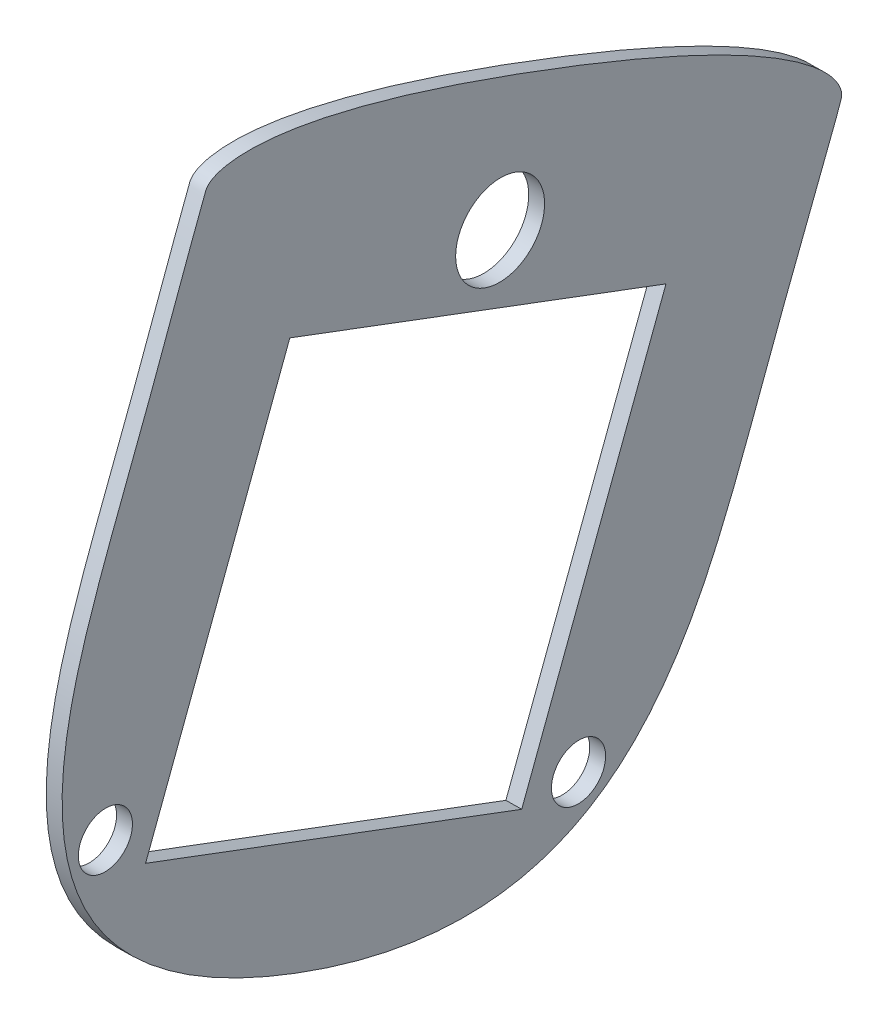
from build123d import *

# Parameters (mm, degrees)
SKETCH3_R               = 11.5
SKETCH3_R_2             = 7
BOSS_EXTRUDE1_DEPTH     = 4
CUT_EXTRUDE1_DEPTH      = 215.260535492
CUT_EXTRUDE1_DEPTH_BACK = 215.260535492


with BuildPart() as part:
    # Sketch3 → Boss-Extrude1 (new body)
    with BuildSketch(Plane(origin=(-1179.548631244, -0.000116963, 14.971959902), x_dir=(0.012691934504714668, 1.258519915397729e-09, 0.9999194541554475), z_dir=(-0.9999194541554426, -9.915104323779702e-08, 0.01269193450471473))):
        with BuildLine():
            add(Edge.make_bspline(
                [(84.377905998, 170.073349611), (84.159146209, 170.614103737), (83.611445829, 171.645847401), (82.482488155, 172.968186199), (81.127474205, 174.032815338), (79.625504141, 174.851852168), (78.048065363, 175.46773216), (75.883744714, 176.067351893), (73.137504594, 176.493777281), (69.848329994, 176.668544918), (66.593182125, 176.609478461), (63.378982778, 176.382288344), (60.20731945, 176.028236357), (57.075408808, 175.575862287), (53.980573733, 175.044418403), (50.919287132, 174.448332656), (47.88858994, 173.797522358), (44.885549546, 173.100779506), (40.914701349, 172.117751202), (36.006584389, 170.801928289), (30.186228838, 169.112782921), (24.416677375, 167.331209331), (18.680858867, 165.470954437), (12.962867526, 163.537381585), (7.246752851, 161.536551279), (-0.392782545, 158.779747051), (-6.165961293, 156.613052059), (-13.94829591, 153.628587787), (-19.689671295, 151.379544623), (-27.213353042, 148.32138638), (-32.801411813, 145.987168864), (-38.34590917, 143.60168497), (-43.854658394, 141.149761563), (-49.33590569, 138.616774109), (-54.793159015, 135.98108416), (-59.322515753, 133.677749539), (-62.932447741, 131.753643877), (-65.631328698, 130.263773352), (-68.320076039, 128.721252072), (-70.99499306, 127.117580989), (-73.651650051, 125.443406131), (-76.283024477, 123.685640179), (-78.878235649, 121.828176014), (-81.420273295, 119.847929263), (-83.880369486, 117.71527683), (-86.209443734, 115.385980118), (-87.966528206, 113.232572142), (-89.175083533, 111.339467663), (-89.936337543, 109.826689125), (-90.505629637, 108.213285186), (-90.801403008, 106.515492236), (-90.756707116, 104.777199898), (-90.474046755, 103.643699911), (-90.084384795, 102.569480158), (-89.841034016, 101.911994363), (-89.541465442, 101.124116148), (-89.39022558, 100.730499307), (-89.238048509, 100.337045258), (-89.085953699, 99.943392047), (-88.933536811, 99.549679266), (-88.730132992, 99.024564877), (-88.373481405, 98.105259575), (-87.862190511, 96.790888427), (-87.245924635, 95.211881522), (-86.627148474, 93.631055189), (-86.006043621, 92.048360056), (-85.382804113, 90.46374254), (-84.757617465, 88.87715131), (-84.130649567, 87.288544234), (-83.502064493, 85.697879827), (-82.662014846, 83.574195152), (-81.608733884, 80.914237535), (-80.340964507, 77.713392714), (-79.070680925, 74.503319887), (-77.799405763, 71.283624353), (-76.528661796, 68.053911872), (-75.259433457, 64.814004725), (-73.992705385, 61.563725615), (-72.730871393, 58.302409625), (-71.476325612, 55.029392149), (-69.810026434, 50.651412822), (-67.733040223, 45.155857397), (-65.192889969, 38.548535597), (-63.002092293, 33.047031135), (-61.179682785, 28.661451936), (-60.006324985, 25.929654584), (-59.043849556, 23.751341903), (-58.309275854, 22.121773372), (-57.56111242, 20.496992747), (-56.798597272, 18.877580965), (-56.02074925, 17.264200326), (-55.227016605, 15.657353665), (-54.415921139, 14.057888772), (-52.755061989, 10.875871272), (-50.113640526, 6.170533326), (-46.214055624, 0.106202959), (-41.879815211, -5.682640377), (-37.071022669, -11.095491143), (-31.749304366, -16.030968238), (-26.892659915, -19.643471605), (-22.77171096, -22.182742504), (-18.509010649, -24.473419396), (-12.935749295, -26.848778135), (-5.968718292, -28.897564796), (1.173532604, -30.167771585), (8.394625718, -30.72426012), (15.629246847, -30.639249774), (22.822176795, -29.99272502), (29.944943646, -28.856179071), (36.971413373, -27.310529127), (46.200981004, -24.782274948), (52.958186926, -22.450860484), (61.81972476, -19.052528076), (68.404073328, -16.267470827), (76.95838131, -11.975451151), (83.217088787, -8.426029178), (89.273667966, -4.508006235), (95.054577362, -0.17870119), (100.490854379, 4.595986977), (105.487967549, 9.838586932), (109.949080227, 15.559099084), (113.759190042, 21.741276151), (116.314593096, 27.234185766), (117.952211322, 31.787728825), (119.31821366, 36.431290069), (120.513597166, 42.364707849), (121.170203082, 49.592689871), (121.126324228, 56.832595149), (120.478268293, 64.034720651), (119.322900557, 71.151036814), (118.140760893, 76.415668184), (117.248089102, 79.892054693), (116.781726531, 81.623608795), (116.297499658, 83.349034553), (115.797104501, 85.068701615), (115.281277137, 86.782601375), (114.751194296, 88.490899321), (114.207808244, 90.193672228), (113.466976478, 92.456831493), (112.512877939, 95.2725252), (110.935633256, 99.751829279), (108.886186051, 105.307189462), (106.357132583, 111.918384124), (104.227035857, 117.393292318), (102.538795023, 121.76266191), (101.283192002, 125.035142736), (100.040826281, 128.303809705), (98.809473322, 131.567557235), (97.586908616, 134.825280211), (96.372281382, 138.076452947), (95.164740704, 141.32055023), (93.962890537, 144.556847836), (92.765334624, 147.784622), (91.769947764, 150.466802963), (90.974582637, 152.607652643), (90.37838073, 154.210763325), (89.782350048, 155.811268218), (89.186340893, 157.409088573), (88.590201531, 159.004144829), (87.993758439, 160.596349912), (87.396830825, 162.185613775), (86.799251704, 163.771852109), (86.300563928, 165.091116339), (85.951056972, 166.013206231), (85.751175589, 166.539698033), (85.601252796, 166.934387123), (85.451115071, 167.328812398), (85.301183692, 167.723146525), (85.150455373, 168.116984379), (84.846354037, 168.903163888), (84.587677769, 169.554813042), (84.377905998, 170.073349611)],
                knots=[0, 0, 0, 0, 0.002677759, 0.005355518, 0.008033277, 0.010711036, 0.013388795, 0.016066554, 0.021422071, 0.026777589, 0.032133107, 0.037488625, 0.042844143, 0.048199661, 0.053555179, 0.058910696, 0.064266214, 0.069621732, 0.07497725, 0.085688286, 0.096399321, 0.107110357, 0.117821393, 0.128532429, 0.139243464, 0.1499545, 0.171376571, 0.171376571, 0.192798208, 0.203509027, 0.214219845, 0.224930663, 0.235641482, 0.2463523, 0.257063118, 0.267773937, 0.273129346, 0.278484755, 0.283840164, 0.289195574, 0.294550983, 0.299906392, 0.305261801, 0.31061721, 0.31597262, 0.321328029, 0.326683438, 0.329361143, 0.332038847, 0.334716552, 0.337394256, 0.340071961, 0.342749665, 0.342749665, 0.345316694, 0.345958451, 0.346600208, 0.347241965, 0.347883722, 0.348525479, 0.349167236, 0.350450751, 0.353017779, 0.355584807, 0.358151836, 0.360718864, 0.363285893, 0.365852921, 0.368419949, 0.370986978, 0.373554006, 0.378688063, 0.38382212, 0.388956176, 0.394090233, 0.39922429, 0.404358347, 0.409492403, 0.41462646, 0.419760517, 0.424894574, 0.435162687, 0.445430801, 0.455698914, 0.460832971, 0.465967028, 0.468534056, 0.471101084, 0.473668113, 0.476235141, 0.478802169, 0.481369198, 0.483936226, 0.486503255, 0.496771368, 0.507039482, 0.517307595, 0.527575709, 0.537843822, 0.548111936, 0.553245992, 0.558380049, 0.568648163, 0.578916276, 0.58918439, 0.599452503, 0.609720617, 0.61998873, 0.630256844, 0.640524957, 0.650793071, 0.671329298, 0.671329298, 0.691871217, 0.702142176, 0.712413135, 0.722684095, 0.732955054, 0.743226014, 0.753496973, 0.763767933, 0.774038892, 0.784309852, 0.789445331, 0.794580811, 0.80485177, 0.81512273, 0.825393689, 0.835664649, 0.845935608, 0.856206568, 0.858774308, 0.861342047, 0.863909787, 0.866477527, 0.869045267, 0.871613007, 0.874180747, 0.876748487, 0.881883966, 0.887019446, 0.897290406, 0.907561365, 0.917832324, 0.922967804, 0.928103284, 0.933238764, 0.938374243, 0.943509723, 0.948645203, 0.953780682, 0.958916162, 0.964051642, 0.969187122, 0.971754862, 0.974322601, 0.976890341, 0.979458081, 0.982025821, 0.984593561, 0.987161301, 0.989729041, 0.99229678, 0.99358065, 0.994222585, 0.99486452, 0.995506455, 0.99614839, 0.996790325, 0.99743226, 1, 1, 1, 1], degree=3))
        make_face()
        with Locations((3.088369787, 120.842225121)):
            Circle(SKETCH3_R, mode=Mode.SUBTRACT)
        with Locations((-17.186648299, -9.215855238)):
            Circle(SKETCH3_R_2, mode=Mode.SUBTRACT)
        Polygon((94.736446449, 27.279702875), (-2.498711879, -10.009217528), (-39.787632282, 87.2259408), (57.447526046, 124.514861203), align=None, mode=Mode.SUBTRACT)
        with Locations((105.127599262, 37.690699139)):
            Circle(SKETCH3_R_2, mode=Mode.SUBTRACT)
    extrude(amount=-BOSS_EXTRUDE1_DEPTH)

    # Sketch7 → Cut-Extrude1 (cut, two sides: drawn at the far end of the back side and taken through both)
    with BuildSketch(Plane(origin=(-1175.548953427, -0.000116566, 14.921192164), x_dir=(-0.012691934504714949, -1.2585199174118205e-09, -0.9999194541554475), z_dir=(0.9999194541554426, 9.915104339647264e-08, -0.012691934504715011)).offset(-CUT_EXTRUDE1_DEPTH_BACK)):
        with BuildLine():
            add(Edge.make_bspline(
                [(-84.377905998, 170.073349611), (-84.587677769, 169.554813042), (-84.846354037, 168.903163888), (-85.150455373, 168.116984379), (-85.301183692, 167.723146525), (-85.451115071, 167.328812398), (-85.601252796, 166.934387123), (-85.751175589, 166.539698033), (-85.951056972, 166.013206232), (-86.300563928, 165.091116339), (-86.799251704, 163.771852109), (-87.396830825, 162.185613775), (-87.993758439, 160.596349912), (-88.590201531, 159.004144829), (-89.186340893, 157.409088573), (-89.782350048, 155.811268218), (-90.37838073, 154.210763325), (-90.974582637, 152.607652643), (-91.769947764, 150.466802963), (-92.765334624, 147.784622001), (-93.962890537, 144.556847836), (-95.164740704, 141.32055023), (-96.372281382, 138.076452947), (-97.586908616, 134.825280211), (-98.809473322, 131.567557235), (-100.040826281, 128.303809705), (-101.283192002, 125.035142736), (-102.538795023, 121.76266191), (-104.227035857, 117.393292318), (-106.357132583, 111.918384124), (-108.886186051, 105.307189462), (-110.935633256, 99.751829279), (-112.512877939, 95.2725252), (-113.466976478, 92.456831493), (-114.207808244, 90.193672228), (-114.751194296, 88.490899321), (-115.281277137, 86.782601375), (-115.797104501, 85.068701616), (-116.297499658, 83.349034553), (-116.781726531, 81.623608795), (-117.248089102, 79.892054693), (-118.140760893, 76.415668184), (-119.322900557, 71.151036814), (-120.478268293, 64.034720651), (-121.126324228, 56.832595149), (-121.170203082, 49.592689871), (-120.513597166, 42.364707849), (-119.31821366, 36.431290069), (-117.952211322, 31.787728825), (-116.314593096, 27.234185766), (-113.759190042, 21.741276151), (-109.949080227, 15.559099084), (-105.487967549, 9.838586932), (-100.490854379, 4.595986977), (-95.054577362, -0.17870119), (-89.273667966, -4.508006235), (-83.217088787, -8.426029178), (-76.95838131, -11.975451151), (-68.404073328, -16.267470827), (-61.81972476, -19.052528076), (-52.958186926, -22.450860484), (-46.200981004, -24.782274948), (-36.971413373, -27.310529127), (-29.944943646, -28.856179071), (-22.822176795, -29.99272502), (-15.629246847, -30.639249774), (-8.394625718, -30.72426012), (-1.173532604, -30.167771585), (5.968718292, -28.897564796), (12.935749295, -26.848778135), (18.509010649, -24.473419396), (22.77171096, -22.182742504), (26.892659915, -19.643471605), (31.749304366, -16.030968238), (37.071022669, -11.095491143), (41.879815211, -5.682640377), (46.214055624, 0.106202959), (50.113640526, 6.170533326), (52.755061989, 10.875871272), (54.415921139, 14.057888772), (55.227016605, 15.657353665), (56.02074925, 17.264200326), (56.798597272, 18.877580965), (57.561112421, 20.496992747), (58.309275854, 22.121773372), (59.043849556, 23.751341903), (60.006324985, 25.929654584), (61.179682785, 28.661451936), (63.002092293, 33.047031135), (65.192889969, 38.548535597), (67.733040223, 45.155857397), (69.810026434, 50.651412822), (71.476325612, 55.029392149), (72.730871393, 58.302409625), (73.992705385, 61.563725615), (75.259433457, 64.814004725), (76.528661796, 68.053911872), (77.799405763, 71.283624353), (79.070680925, 74.503319887), (80.340964507, 77.713392714), (81.608733884, 80.914237535), (82.662014846, 83.574195152), (83.502064493, 85.697879827), (84.130649567, 87.288544235), (84.757617465, 88.87715131), (85.382804113, 90.46374254), (86.006043621, 92.048360056), (86.627148474, 93.631055189), (87.245924635, 95.211881522), (87.862190511, 96.790888427), (88.373481405, 98.105259575), (88.730132992, 99.024564877), (88.933536811, 99.549679266), (89.085953699, 99.943392047), (89.238048509, 100.337045258), (89.39022558, 100.730499307), (89.541465442, 101.124116148), (89.841034016, 101.911994363), (90.084384795, 102.569480158), (90.474046755, 103.643699911), (90.756707116, 104.777199898), (90.801403008, 106.515492236), (90.505629637, 108.213285186), (89.936337543, 109.826689125), (89.175083533, 111.339467663), (87.966528206, 113.232572142), (86.209443734, 115.385980118), (83.880369486, 117.71527683), (81.420273295, 119.847929263), (78.878235649, 121.828176014), (76.283024477, 123.685640179), (73.651650051, 125.443406131), (70.99499306, 127.117580989), (68.320076039, 128.721252072), (65.631328698, 130.263773352), (62.932447741, 131.753643877), (59.322515753, 133.677749539), (54.793159015, 135.98108416), (49.33590569, 138.616774109), (43.854658394, 141.149761563), (38.34590917, 143.60168497), (32.801411813, 145.987168864), (27.213353042, 148.32138638), (19.689671295, 151.379544623), (13.94829591, 153.628587787), (6.165961293, 156.613052059), (0.392782545, 158.779747051), (-7.246752851, 161.536551279), (-12.962867526, 163.537381585), (-18.680858867, 165.470954437), (-24.416677375, 167.331209331), (-30.186228838, 169.112782921), (-36.006584389, 170.801928289), (-40.914701349, 172.117751202), (-44.885549546, 173.100779506), (-47.88858994, 173.797522358), (-50.919287132, 174.448332656), (-53.980573733, 175.044418403), (-57.075408808, 175.575862287), (-60.20731945, 176.028236357), (-63.378982778, 176.382288344), (-66.593182125, 176.609478461), (-69.848329994, 176.668544918), (-73.137504594, 176.493777281), (-75.883744714, 176.067351893), (-78.048065363, 175.46773216), (-79.625504141, 174.851852168), (-81.127474205, 174.032815338), (-82.482488155, 172.968186199), (-83.611445829, 171.645847401), (-84.159146209, 170.614103737), (-84.377905998, 170.073349611)],
                knots=[0, 0, 0, 0, 0.00256774, 0.003209675, 0.00385161, 0.004493545, 0.00513548, 0.005777415, 0.00641935, 0.00770322, 0.010270959, 0.012838699, 0.015406439, 0.017974179, 0.020541919, 0.023109659, 0.025677399, 0.028245138, 0.030812878, 0.035948358, 0.041083838, 0.046219318, 0.051354797, 0.056490277, 0.061625757, 0.066761236, 0.071896716, 0.077032196, 0.082167676, 0.092438635, 0.102709594, 0.112980554, 0.118116034, 0.123251513, 0.125819253, 0.128386993, 0.130954733, 0.133522473, 0.136090213, 0.138657953, 0.141225692, 0.143793432, 0.154064392, 0.164335351, 0.174606311, 0.18487727, 0.19514823, 0.205419189, 0.210554669, 0.215690148, 0.225961108, 0.236232067, 0.246503027, 0.256773986, 0.267044946, 0.277315905, 0.287586865, 0.297857824, 0.308128783, 0.328670702, 0.328670702, 0.349206929, 0.359475043, 0.369743156, 0.38001127, 0.390279383, 0.400547497, 0.41081561, 0.421083724, 0.431351837, 0.441619951, 0.446754008, 0.451888064, 0.462156178, 0.472424291, 0.482692405, 0.492960518, 0.503228632, 0.513496745, 0.516063774, 0.518630802, 0.521197831, 0.523764859, 0.526331887, 0.528898916, 0.531465944, 0.534032972, 0.539167029, 0.544301086, 0.554569199, 0.564837313, 0.575105426, 0.580239483, 0.58537354, 0.590507597, 0.595641653, 0.60077571, 0.605909767, 0.611043824, 0.61617788, 0.621311937, 0.626445994, 0.629013022, 0.631580051, 0.634147079, 0.636714107, 0.639281136, 0.641848164, 0.644415193, 0.646982221, 0.649549249, 0.650832764, 0.651474521, 0.652116278, 0.652758035, 0.653399792, 0.654041549, 0.654683306, 0.657250335, 0.657250335, 0.659928039, 0.662605744, 0.665283448, 0.667961153, 0.670638857, 0.673316562, 0.678671971, 0.68402738, 0.68938279, 0.694738199, 0.700093608, 0.705449017, 0.710804426, 0.716159836, 0.721515245, 0.726870654, 0.732226063, 0.742936882, 0.7536477, 0.764358518, 0.775069337, 0.785780155, 0.796490973, 0.807201792, 0.828623429, 0.828623429, 0.8500455, 0.860756536, 0.871467571, 0.882178607, 0.892889643, 0.903600679, 0.914311714, 0.92502275, 0.930378268, 0.935733786, 0.941089304, 0.946444821, 0.951800339, 0.957155857, 0.962511375, 0.967866893, 0.973222411, 0.978577929, 0.983933446, 0.986611205, 0.989288964, 0.991966723, 0.994644482, 0.997322241, 1, 1, 1, 1], degree=3))
        make_face()
        with BuildLine():
            add(Edge.make_bspline(
                [(-55.838187915, -16.709006158), (-52.759337997, -17.889720928), (-49.661983597, -18.990343471), (-43.424834776, -21.007897067), (-40.285339282, -21.926121954), (-33.95577084, -23.543659302), (-30.765739806, -24.243153174), (-24.323562972, -25.373292), (-21.071285257, -25.80336599), (-16.956515566, -26.127044786), (-16.13107285, -26.181008467), (-14.474843208, -26.265804689), (-13.644083138, -26.296583322), (-11.159336117, -26.351552112), (-9.507722441, -26.33871842), (-4.56891853, -26.137757422), (-1.297671445, -25.78812209), (2.75947241, -25.027771127), (3.569293687, -24.859416622), (5.185532941, -24.48823135), (5.993774985, -24.284843975), (8.399228703, -23.62386815), (9.971586882, -23.117864616), (14.59508484, -21.404330649), (17.551875111, -19.999661846), (21.794962246, -17.49127934), (23.177855526, -16.589398802), (25.205437134, -15.138878945), (25.873321109, -14.639057075), (27.181089383, -13.61683966), (27.82258487, -13.0932523), (30.970670269, -10.415491982), (33.301165917, -8.083945447), (36.567419196, -4.355468218), (37.618355058, -3.072810508), (39.646972848, -0.440910767), (40.616764085, 0.89780165), (43.41158056, 4.97251373), (45.123166438, 7.766516639), (48.319174891, 13.470674457), (49.80192959, 16.381682177), (52.604978389, 22.286766155), (53.932733295, 25.277027591), (57.766509503, 34.324247615), (60.125505516, 40.458843544), (63.606479044, 49.676664863), (64.757269322, 52.75289458), (67.079227522, 58.897611358), (68.252385001, 61.965346434), (71.805480144, 71.155752316), (74.213167247, 77.267444835), (79.035873395, 89.487950535), (81.4480822, 95.597900163), (83.986552852, 102.09928969), (84.135965374, 102.481689522), (84.425807877, 103.249939387), (84.567492146, 103.635367968), (84.77554294, 104.214978023), (84.878518361, 104.505119663), (84.980118287, 104.795702276), (85.047566655, 104.98951536), (85.079528822, 105.08698679), (85.158366178, 105.384866893), (85.192220288, 105.591761774), (85.218840022, 106.001049334), (85.212210831, 106.204511025), (85.142942631, 106.811968564), (85.034682908, 107.215103604), (84.756266114, 107.982246014), (84.58391238, 108.351859183), (84.196478762, 109.07309285), (83.981597468, 109.423824913), (83.529832597, 110.100642332), (83.291405501, 110.428377399), (82.547651702, 111.387356723), (82.015005816, 111.995356412), (80.90121655, 113.170091628), (80.319687169, 113.737050706), (78.523285007, 115.390418779), (77.270566549, 116.418862513), (74.700393813, 118.389068762), (73.381782646, 119.329282204), (70.698288152, 121.147750697), (69.331688183, 122.026795772), (65.195549199, 124.584259715), (62.387747704, 126.186203749), (56.709877987, 129.26273903), (53.839157229, 130.73599566), (48.05301442, 133.591082335), (45.137324469, 134.972364449), (36.339127875, 139.011642383), (30.406163247, 141.566437578), (18.451721324, 146.494994931), (12.437018382, 148.86491324), (0.35754279, 153.46238524), (-5.709468954, 155.687268268), (-17.919710477, 159.930649526), (-24.065773928, 161.95253874), (-33.353609542, 164.737568455), (-36.461495834, 165.624091402), (-42.709502296, 167.284247216), (-45.851639202, 168.058795114), (-50.590156542, 169.093614563), (-52.173909492, 169.417459754), (-55.352414722, 170.01051922), (-56.948045582, 170.280112504), (-60.149000466, 170.746654764), (-61.753664218, 170.943774593), (-64.975016537, 171.234172775), (-66.592147959, 171.328539092), (-69.016230348, 171.346695587), (-69.82447795, 171.331719432), (-71.441563727, 171.245353904), (-72.246521587, 171.174124865), (-73.839453931, 170.95102252), (-74.628475547, 170.80034663), (-75.792869188, 170.473749314), (-76.177879858, 170.348483587), (-76.938002992, 170.045932306), (-77.306782857, 169.871111386), (-78.004511435, 169.450955954), (-78.338069271, 169.204193987), (-78.755434382, 168.759826777), (-78.882714584, 168.596790562), (-79.046744367, 168.337519906), (-79.096768841, 168.249130006), (-79.188247373, 168.068727684), (-79.228553078, 167.976229878), (-79.579983448, 167.138964498), (-79.883718859, 166.391073652), (-80.318893746, 165.260602826), (-80.460330216, 164.882248938), (-80.745038826, 164.126320976), (-80.887268511, 163.748310365), (-81.313688453, 162.614177839), (-81.597507197, 161.857916914), (-84.149346677, 155.050622227), (-86.400830358, 148.993396144), (-90.916048884, 136.883545228), (-93.18367867, 130.832393289), (-96.650644953, 121.780339437), (-97.820732844, 118.768429731), (-100.172765751, 112.749163788), (-101.353160351, 109.741198883), (-103.682933397, 103.713451968), (-104.832999899, 100.693932106), (-107.06302069, 94.628179739), (-108.143649663, 91.579888101), (-111.206491331, 82.395365914), (-113.022345303, 76.21840425), (-114.962254827, 66.765882813), (-115.481062405, 63.584534651), (-116.004417287, 58.751688301), (-116.136190153, 57.126095999), (-116.299640088, 53.886397681), (-116.331785511, 52.269890167), (-116.265881363, 47.431309322), (-116.006818369, 44.220088245), (-115.353260753, 40.228285525), (-115.206066471, 39.431035914), (-114.877610691, 37.838832811), (-114.695820924, 37.041885151), (-114.101862702, 34.672495827), (-113.641676979, 33.121539299), (-112.066596073, 28.555418513), (-110.753583064, 25.628605856), (-108.407962072, 21.406111138), (-107.56336921, 20.026582827), (-106.202155778, 17.999354666), (-105.732692275, 17.330754564), (-104.772748009, 16.019910542), (-104.281147411, 15.375952305), (-101.768282042, 12.210246489), (-99.583575675, 9.849625709), (-94.925581265, 5.412878694), (-92.452216737, 3.336827859), (-88.562681757, 0.399697733), (-87.244321885, -0.543609701), (-84.574455513, -2.362483973), (-83.221952769, -3.238790962), (-79.117613798, -5.779405252), (-76.319483327, -7.35641752), (-70.622341266, -10.320214944), (-67.723326136, -11.706993423), (-63.312072733, -13.668872588), (-61.831048408, -14.302832051), (-59.594632708, -15.225714166), (-58.472704717, -15.680140316), (-57.157500429, -16.198446588), (-56.498353774, -16.454687306), (-56.215534329, -16.563886222), (-56.026915465, -16.636548663), (-55.934401975, -16.672108822), (-55.838187915, -16.709006158)],
                knots=[0, 0, 0, 0, 0.015625, 0.015625, 0.03125, 0.03125, 0.046875, 0.046875, 0.0625, 0.0625, 0.06640625, 0.06640625, 0.0703125, 0.0703125, 0.078125, 0.078125, 0.09375, 0.09375, 0.09765625, 0.09765625, 0.1015625, 0.1015625, 0.109375, 0.109375, 0.125, 0.125, 0.1328125, 0.1328125, 0.13671875, 0.13671875, 0.140625, 0.140625, 0.15625, 0.15625, 0.1640625, 0.1640625, 0.171875, 0.171875, 0.1875, 0.1875, 0.203125, 0.203125, 0.21875, 0.21875, 0.25, 0.25, 0.265625, 0.265625, 0.28125, 0.28125, 0.3125, 0.3125, 0.34375, 0.34375, 0.345703125, 0.345703125, 0.34765625, 0.34765625, 0.348632812, 0.349121094, 0.349121094, 0.349609375, 0.349609375, 0.350585937, 0.350585937, 0.3515625, 0.3515625, 0.353515625, 0.353515625, 0.35546875, 0.35546875, 0.357421875, 0.357421875, 0.359375, 0.359375, 0.36328125, 0.36328125, 0.3671875, 0.3671875, 0.375, 0.375, 0.3828125, 0.3828125, 0.390625, 0.390625, 0.40625, 0.40625, 0.421875, 0.421875, 0.4375, 0.4375, 0.46875, 0.46875, 0.5, 0.5, 0.53125, 0.53125, 0.5625, 0.5625, 0.578125, 0.578125, 0.59375, 0.59375, 0.6015625, 0.6015625, 0.609375, 0.609375, 0.6171875, 0.6171875, 0.625, 0.625, 0.62890625, 0.62890625, 0.6328125, 0.6328125, 0.63671875, 0.63671875, 0.638671875, 0.638671875, 0.640625, 0.640625, 0.642578125, 0.642578125, 0.643554687, 0.643554687, 0.644042969, 0.644042969, 0.64453125, 0.64453125, 0.6484375, 0.6484375, 0.650390625, 0.650390625, 0.65234375, 0.65234375, 0.65625, 0.65625, 0.6875, 0.6875, 0.71875, 0.71875, 0.734375, 0.734375, 0.75, 0.75, 0.765625, 0.765625, 0.78125, 0.78125, 0.8125, 0.8125, 0.828125, 0.828125, 0.8359375, 0.8359375, 0.84375, 0.84375, 0.859375, 0.859375, 0.86328125, 0.86328125, 0.8671875, 0.8671875, 0.875, 0.875, 0.890625, 0.890625, 0.8984375, 0.8984375, 0.90234375, 0.90234375, 0.90625, 0.90625, 0.921875, 0.921875, 0.9375, 0.9375, 0.9453125, 0.9453125, 0.953125, 0.953125, 0.96875, 0.96875, 0.984375, 0.984375, 0.9921875, 0.9921875, 0.99609375, 0.998046875, 0.999023437, 0.999511719, 0.999511719, 1, 1, 1, 1], degree=3))
        make_face(mode=Mode.SUBTRACT)
    extrude(amount=CUT_EXTRUDE1_DEPTH + CUT_EXTRUDE1_DEPTH_BACK, mode=Mode.SUBTRACT)


solid = part.part
